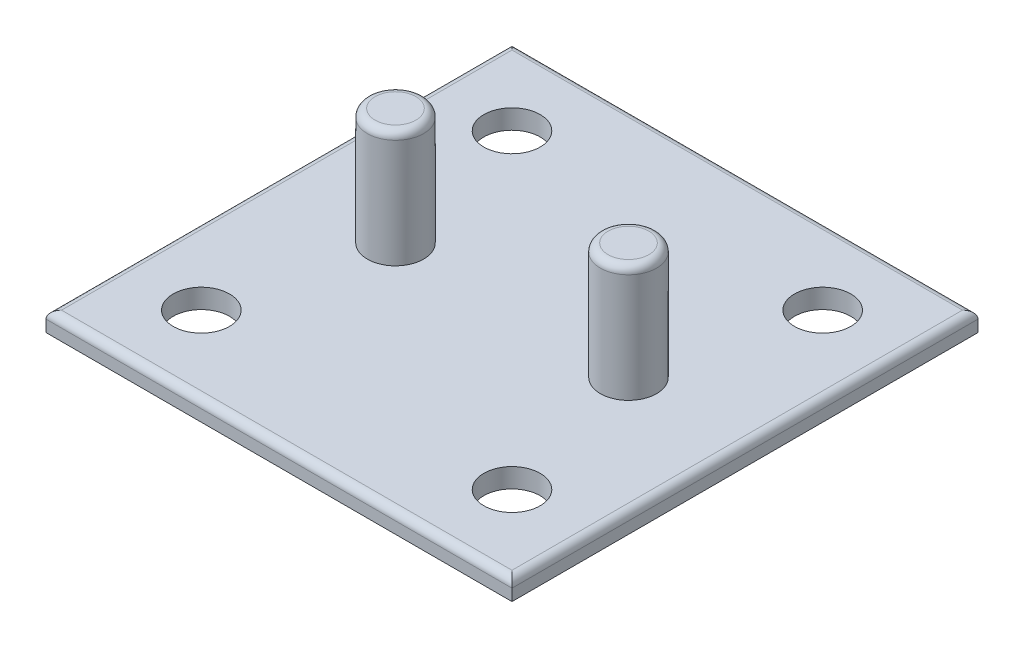
from build123d import *

# Parameters (mm, degrees)
ESQUISSE3_W             = 120
ESQUISSE3_H             = 120
BOSS_EXTRU_2_DEPTH      = 5
ESQUISSE5_R             = 7.25
ENL_V_MAT_EXTRU_1_DEPTH = 5
ENL_V_START             = 5
ESQUISSE6_R             = 7.25
ENL_V_MAT_EXTRU_7_DEPTH = 5
ESQUISSE11_R            = 7.25
BOSS_EXTRU_4_DEPTH      = 30
ESQUISSE14_R            = 7.25
BOSS_EXTRU_6_DEPTH      = 30
CONG_2_R                = 2
CONG_3_R                = 2
CONG_4_R                = 2


with BuildPart() as part:
    # Esquisse3 → Boss.-Extru.2 (new body)
    with BuildSketch(Plane(origin=(0, 0, 0), x_dir=(1, 0, 0), z_dir=(0, 1, 0))):
        Rectangle(ESQUISSE3_W, ESQUISSE3_H)
    extrude(amount=BOSS_EXTRU_2_DEPTH)

    # Esquisse5 → Enlèv. mat.-Extru.1 (cut)
    with BuildSketch(Plane(origin=(0, 5, 0), x_dir=(1, 0, 0), z_dir=(0, 1, 0))):
        with Locations((-40, 40)):
            Circle(ESQUISSE5_R)
    extrude(amount=-ENL_V_MAT_EXTRU_1_DEPTH, mode=Mode.SUBTRACT)

    # Esquisse6 → Enlèv. mat.-Extru.7 (cut)
    with BuildSketch(Plane(origin=(0, 0, 0), x_dir=(1, 0, 0), z_dir=(0, 1, 0)).offset(ENL_V_START)):
        with Locations((-40, 40)):
            Circle(ESQUISSE6_R)
        with Locations((40, 40)):
            Circle(ESQUISSE6_R)
        with Locations((-40, -40)):
            Circle(ESQUISSE6_R)
        with Locations((40, -40)):
            Circle(ESQUISSE6_R)
    extrude(amount=-ENL_V_MAT_EXTRU_7_DEPTH, mode=Mode.SUBTRACT)

    # Esquisse11 → Boss.-Extru.4 (add)
    with BuildSketch(Plane(origin=(0, 5, 0), x_dir=(1, 0, 0), z_dir=(0, 1, 0))):
        with Locations((-30, 0)):
            Circle(ESQUISSE11_R)
    extrude(amount=BOSS_EXTRU_4_DEPTH)

    # Esquisse14 → Boss.-Extru.6 (add)
    with BuildSketch(Plane(origin=(0, 5, 0), x_dir=(1, 0, 0), z_dir=(0, 1, 0))):
        with Locations((30, 0)):
            Circle(ESQUISSE14_R)
        with Locations((-30, 0)):
            Circle(ESQUISSE14_R)
    extrude(amount=BOSS_EXTRU_6_DEPTH)

    # Congé2
    cong_2_edges = [part.edges().sort_by_distance(p)[0] for p in [
        (22.75, 35, 0),
    ]]
    fillet(cong_2_edges, radius=CONG_2_R)

    # Congé3
    cong_3_edges = [part.edges().sort_by_distance(p)[0] for p in [
        (-37.25, 35, 0),
    ]]
    fillet(cong_3_edges, radius=CONG_3_R)

    # Congé4
    cong_4_edges = [part.edges().sort_by_distance(p)[0] for p in [
        (60, 5, 0),
        (0, 5, -60),
        (-60, 5, 0),
        (0, 5, 60),
    ]]
    fillet(cong_4_edges, radius=CONG_4_R)


solid = part.part
